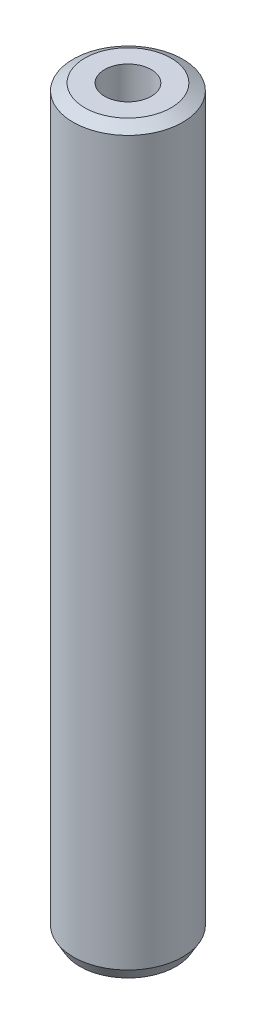
from build123d import *
from OCP.BRepFilletAPI import BRepFilletAPI_MakeChamfer

# Parameters (mm, degrees)
SKETCH1_R           = 10
BOSS_EXTRUDE1_DEPTH = 135.342148538
SKETCH2_R           = 4.246883096
CUT_EXTRUDE1_DEPTH  = 137.079010765
CHAMFER1_SIZE       = 1.229709753
CHAMFER1_SIZE2      = 2.129919771


with BuildPart() as part:
    # Sketch1 → Boss-Extrude1 (new body)
    with BuildSketch(Plane(origin=(0, 0, 0), x_dir=(1, 0, 0), z_dir=(0, 1, 0))):
        Circle(SKETCH1_R)
    extrude(amount=BOSS_EXTRUDE1_DEPTH)

    # Sketch2 → Cut-Extrude1 (cut, through all)
    with BuildSketch(Plane(origin=(0, 0, 0), x_dir=(1, 0, 0), z_dir=(0, 1, 0))):
        Circle(SKETCH2_R)
    extrude(amount=CUT_EXTRUDE1_DEPTH, mode=Mode.SUBTRACT)

    # Chamfer1: one chamfer whose edges measure the first distance from different faces: ONE call of the kernel's chamfer builder (chamfer() names one face for all edges)
    chamfer1_edges_1 = [part.edges().sort_by_distance(p)[0] for p in [
        (-10, 135.342148538, 0),
    ]]
    chamfer1_side_1 = [part.faces().sort_by_distance(p)[0] for p in [
        (-10, 67.671074269, 0),
    ]]
    chamfer1_edges_2 = [part.edges().sort_by_distance(p)[0] for p in [
        (-10, 0, 0),
    ]]
    chamfer1_side_2 = [part.faces().sort_by_distance(p)[0] for p in [
        (-9.717157288, 0, 0),
    ]]
    chamfer1 = BRepFilletAPI_MakeChamfer(part.part.solid().wrapped)
    for e in chamfer1_edges_1:
        chamfer1.Add(CHAMFER1_SIZE, CHAMFER1_SIZE2, e.wrapped, chamfer1_side_1[0].wrapped)  # the first distance lies on this face
    for e in chamfer1_edges_2:
        chamfer1.Add(CHAMFER1_SIZE, CHAMFER1_SIZE2, e.wrapped, chamfer1_side_2[0].wrapped)  # the first distance lies on this face
    add(Compound.cast(chamfer1.Shape()), mode=Mode.REPLACE)


solid = part.part
